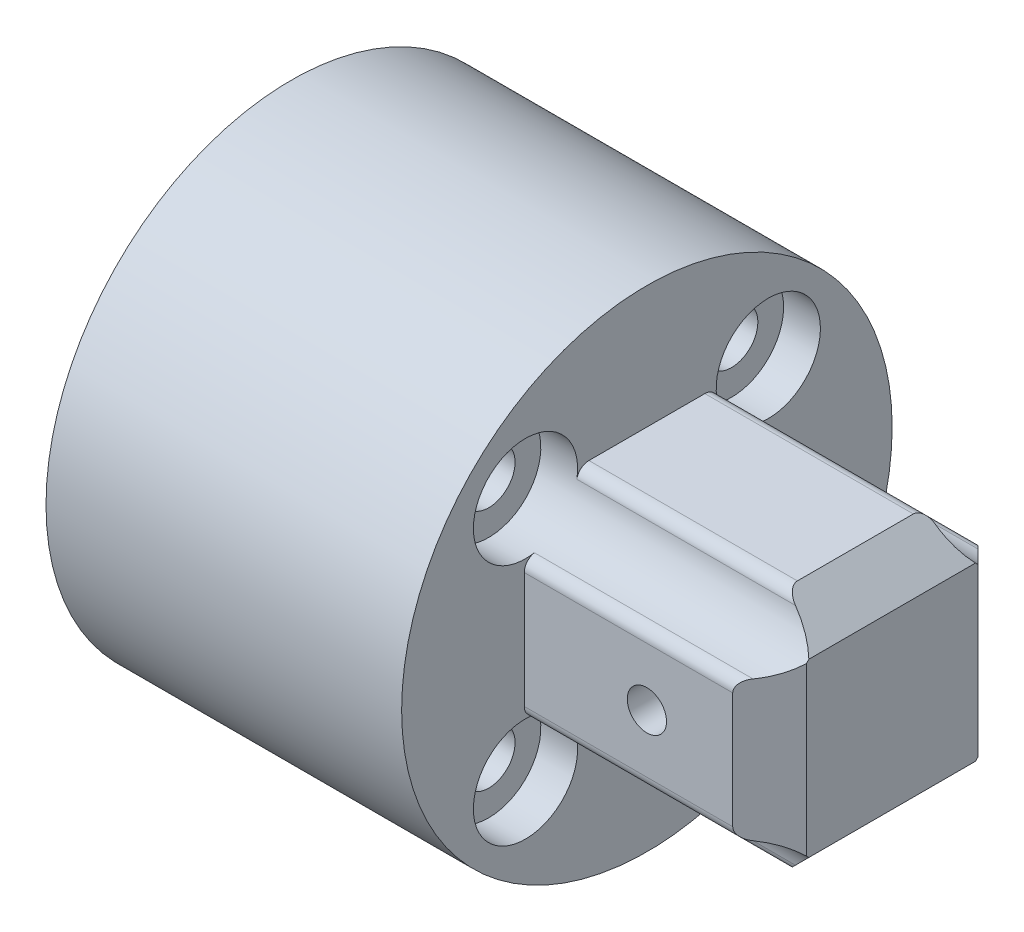
from build123d import *

# Parameters (mm, degrees)
SKETCH_1_R               = 20
EXTRUDE_1_DEPTH          = 10
SKETCH_2_W               = 15
SKETCH_2_H               = 30.5
CUT_EXTRUDE_1_DEPTH      = 4
SKETCH_3_R               = 8.75
CUT_EXTRUDE_2_DEPTH      = 4
EXTRUDE_START            = 19
SKETCH_4_R               = 20
SKETCH_4_W               = 18
SKETCH_4_H               = 32
EXTRUDE_2_DEPTH          = 19
FILLET_1_R               = 3
SKETCH_5_R               = 2.5
CUT_EXTRUDE_3_DEPTH      = 20
FILLET_2_R               = 3
SKETCH_6_R               = 2.15
CUT_EXTRUDE_4_DEPTH      = 43
FILLET_3_R               = 1
SKETCH_7_R               = 4.25
CUT_EXTRUDE_5_DEPTH      = 3
PATTERN_CIRCULAR_1_COUNT = 4
SKETCH_8_W               = 20
SKETCH_8_H               = 20
EXTRUDE_3_DEPTH          = 20
SKETCH_9_R               = 1.6
CUT_EXTRUDE_6_DEPTH      = 27
CHAMFER_1_SIZE           = 3
CUT_EXTRUDE_START        = 49
SKETCH_11_R              = 4.25
CUT_EXTRUDE_7_DEPTH      = 49
SKETCH_12_W              = 3
SKETCH_12_H              = 5
CUT_EXTRUDE_8_DEPTH      = 49
FILLET_4_R               = 1
FILLET_5_R               = 1
FILLET_6_R               = 1
FILLET_7_R               = 1


with BuildPart() as part:
    # 草图1 → 凸台-拉伸1 (new body)
    with BuildSketch(Plane(origin=(0, 0, 0), x_dir=(0, 0, -1), z_dir=(1, 0, 0))):
        Circle(SKETCH_1_R)
    extrude(amount=EXTRUDE_1_DEPTH)

    # 草图2 → 切除-拉伸1 (cut)
    with BuildSketch(Plane.ZY):
        Rectangle(SKETCH_2_W, SKETCH_2_H)
    extrude(amount=-CUT_EXTRUDE_1_DEPTH, mode=Mode.SUBTRACT)

    # 草图3 → 切除-拉伸2 (cut)
    with BuildSketch(Plane.ZY.offset(-4)):
        Circle(SKETCH_3_R)
    extrude(amount=CUT_EXTRUDE_2_DEPTH, mode=Mode.SUBTRACT)

    # 草图4 → 凸台-拉伸2 (add)
    with BuildSketch(Plane.ZY.offset(EXTRUDE_START)):
        Circle(SKETCH_4_R)
        Rectangle(SKETCH_4_W, SKETCH_4_H, mode=Mode.SUBTRACT)
    extrude(amount=-EXTRUDE_2_DEPTH)

    # 圆角1
    fillet_1_edges = [part.edges().sort_by_distance(p)[0] for p in [
        (-9.5, 16, 9),
        (-9.5, 16, -9),
        (-9.5, -16, -9),
        (-9.5, -16, 9),
    ]]
    fillet(fillet_1_edges, radius=FILLET_1_R)

    # 草图5 → 切除-拉伸3 (cut)
    with BuildSketch(Plane.ZY.offset(19)):
        with Locations((0, -16)):
            Circle(SKETCH_5_R)
        with Locations((0, 16)):
            Circle(SKETCH_5_R)
    extrude(amount=-CUT_EXTRUDE_3_DEPTH, mode=Mode.SUBTRACT)

    # 圆角2
    # the kernel refuses this fillet: 3 mm, written as the material it takes off along each edge
    with BuildSketch(Plane(origin=(-24.274430572, -16, 2.5), x_dir=(0, -0.9586814917396833, -0.2844816292764363), z_dir=(1, 0, 0))) as fillet_2_piece_1:
        with BuildLine():
            CenterArc((2.275853034, -2.876044475), FILLET_2_R, 106.527865575, 56.944268849)
            Line((-0.600191441, -2.022599587), (0, 0))
            ThreePointArc((0, 0), (0.711204073, -0.103296271), (1.422408146, 0))
        make_face()
    extrude(amount=24.274430572, mode=Mode.SUBTRACT)
    with BuildSketch(Plane(origin=(0, -16, -2.5), x_dir=(0, 0, -1), z_dir=(-1, 0, 0))) as fillet_2_piece_2:
        with BuildLine():
            CenterArc((2.109772229, 3), FILLET_2_R, 213.055731151, 56.944268849)
            ThreePointArc((-0.404648987, 1.363636364), (-0.103296271, 0.711204073), (0, 0))
            Line((0, 0), (2.109772229, 0))
        make_face()
    extrude(amount=24.274430572, mode=Mode.SUBTRACT)
    with BuildSketch(Plane(origin=(0, 16, -2.5), x_dir=(0, 0.9586814917396834, 0.2844816292764354), z_dir=(-1, 0, 0))) as fillet_2_piece_3:
        with BuildLine():
            CenterArc((2.275853034, 2.876044475), FILLET_2_R, 196.527865575, 56.944268849)
            Line((-0.600191441, 2.022599587), (0, 0))
            ThreePointArc((0, 0), (0.711204073, 0.103296271), (1.422408146, 0))
        make_face()
    extrude(amount=24.274430572, mode=Mode.SUBTRACT)
    with BuildSketch(Plane(origin=(-24.274430572, 16, 2.5), x_dir=(0, 0, 1), z_dir=(1, 0, 0))) as fillet_2_piece_4:
        with BuildLine():
            CenterArc((2.109772229, -3), FILLET_2_R, 90, 56.944268849)
            ThreePointArc((-0.404648987, -1.363636364), (-0.103296271, -0.711204073), (0, 0))
            Line((0, 0), (2.109772229, 0))
        make_face()
    extrude(amount=24.274430572, mode=Mode.SUBTRACT)

    # 草图6 → 切除-拉伸4 (cut)
    with BuildSketch(Plane(origin=(10, 0, 0), x_dir=(0, 0, -1), z_dir=(1, 0, 0))):
        with Locations((9.899494937, -9.899494937)):
            Circle(SKETCH_6_R)
        with Locations((-9.899494937, -9.899494937)):
            Circle(SKETCH_6_R)
        with Locations((-9.899494937, 9.899494937)):
            Circle(SKETCH_6_R)
        with Locations((9.899494937, 9.899494937)):
            Circle(SKETCH_6_R)
    extrude(amount=-CUT_EXTRUDE_4_DEPTH, mode=Mode.SUBTRACT)

    # 圆角3
    # the kernel refuses this fillet: 1 mm, written as the material it takes off along each edge
    with BuildSketch(Plane(origin=(-21.98900269, -7.946699797, 9), x_dir=(0, 0.1985408891964352, 0.9800926054802622), z_dir=(1, 0, 0)), Plane(origin=(-21.98900269, 7.946699797, -9), x_dir=(0, -0.19854088919647347, -0.9800926054802545), z_dir=(1, 0, 0))) as fillet_3_piece_1:
        with BuildLine():
            CenterArc((1.217468306, -0.973258884), FILLET_3_R, 103.280057781, 88.171589383)
            Line((0.237375701, -1.171799774), (0, 0))
            ThreePointArc((0, 0), (0.493878653, -0.057493399), (0.987757305, 0))
        make_face()
    extrude(amount=21.98900269, mode=Mode.SUBTRACT)
    with BuildSketch(Plane(origin=(-21.959087911, -11.852290077, 9), x_dir=(0, -0.999999983485678, -0.00018173784322620402), z_dir=(1, 0, 0)), Plane(origin=(-21.959087911, 11.852290077, -9), x_dir=(0, 0.9999999834856781, 0.00018173784322619477), z_dir=(1, 0, 0))) as fillet_3_piece_2:
        with BuildLine():
            CenterArc((1.195428513, -0.999930456), FILLET_3_R, 90.675724778, 87.490671362)
            Line((0.195940547, -0.967933494), (0.09599175, -0.964733798))
            ThreePointArc((0.09599175, -0.964733798), (0.056286672, -0.492404834), (-0.090835283, -0.041820466))
            Line((-0.090835283, -0.041820466), (1.8174e-05, 0.099999998))
            ThreePointArc((1.8174e-05, 0.099999998), (1.147728078, 0.099791416), (1.182455829, 0.099993046))
            Line((1.182455829, 0.099993046), (1.183635164, 0))
        make_face()
    extrude(amount=21.959087911, mode=Mode.SUBTRACT)
    with BuildSketch(Plane(origin=(-21.959087911, -11.852290077, -9), x_dir=(0, -0.19858553154825268, -0.98008356105982), z_dir=(1, 0, 0)), Plane(origin=(-21.959087911, 11.852290077, 9), x_dir=(0, 0.19858553154822475, 0.9800835610598256), z_dir=(1, 0, 0))) as fillet_3_piece_3:
        with BuildLine():
            CenterArc((1.217233349, -0.973269347), FILLET_3_R, 103.277447997, 87.490671362)
            Line((0.234841987, -1.160104066), (0.136602851, -1.178787538))
            ThreePointArc((0.136602851, -1.178787538), (0.129910229, -1.144710182), (-0.098008356, -0.019858553))
            Line((-0.098008356, -0.019858553), (0.022966667, 0.097326935))
            ThreePointArc((0.022966667, 0.097326935), (0.49378334, 0.042529095), (0.964600013, 0.097326935))
            Line((0.964600013, 0.097326935), (0.987566679, 0))
        make_face()
    extrude(amount=21.959087911, mode=Mode.SUBTRACT)
    with BuildSketch(Plane(origin=(-21.98900269, -7.946699797, -9), x_dir=(0, 1, 0), z_dir=(1, 0, 0)), Plane(origin=(-21.98900269, 7.946699797, 9), x_dir=(0, -1, 0), z_dir=(1, 0, 0))) as fillet_3_piece_4:
        with BuildLine():
            CenterArc((1.195601076, -1), FILLET_3_R, 90, 88.171589383)
            ThreePointArc((0.196110214, -0.968093631), (0.154403962, -0.472632025), (0, 0))
            Line((0, 0), (1.195601076, 0))
        make_face()
    extrude(amount=21.98900269, mode=Mode.SUBTRACT)

    # 草图7 → 切除-拉伸5 (cut)
    with BuildSketch(Plane(origin=(10, 0, 0), x_dir=(0, 0, -1), z_dir=(1, 0, 0))):
        with Locations((9.899494937, -9.899494937)):
            Circle(SKETCH_7_R)
    cut_extrude_5 = extrude(amount=-CUT_EXTRUDE_5_DEPTH, mode=Mode.SUBTRACT)

    # 阵列(圆周)1: 切除-拉伸5 ×4 about axis
    pattern_circular_1_axis = Axis((0, 0, 0), (1, 0, 0))
    for i in range(1, PATTERN_CIRCULAR_1_COUNT):
        add(cut_extrude_5.rotate(pattern_circular_1_axis, i * 360 / PATTERN_CIRCULAR_1_COUNT), mode=Mode.SUBTRACT)

    # 草图8 → 凸台-拉伸3 (add)
    with BuildSketch(Plane(origin=(10, 0, 0), x_dir=(0, 0, -1), z_dir=(1, 0, 0))):
        Rectangle(SKETCH_8_W, SKETCH_8_H)
    extrude(amount=EXTRUDE_3_DEPTH)

    # 草图9 → 切除-拉伸6 (cut)
    with BuildSketch(Plane(origin=(0, 0, -10), x_dir=(-1, 0, 0), z_dir=(0, 0, -1))):
        with Locations((-20, 0)):
            Circle(SKETCH_9_R)
    extrude(amount=-CUT_EXTRUDE_6_DEPTH, mode=Mode.SUBTRACT)

    # 倒角1
    chamfer_1_edges = [part.edges().sort_by_distance(p)[0] for p in [
        (30, 0, -10),
        (30, 10, 0),
        (30, 0, 10),
        (30, -10, 0),
    ]]
    chamfer(chamfer_1_edges, length=CHAMFER_1_SIZE)

    # 草图11 → 切除-拉伸7 (cut)
    with BuildSketch(Plane(origin=(10, 0, 0), x_dir=(0, 0, -1), z_dir=(1, 0, 0)).offset(CUT_EXTRUDE_START)):
        with Locations(Location((-9.899494937, 9.899494937, 0), (0, 0, 1.355071251))):
            Circle(SKETCH_11_R)
        with Locations(Location((-9.899494937, -9.899494937, 0), (0, 0, 358.644928749))):
            Circle(SKETCH_11_R)
        with Locations((9.899494937, -9.899494937)):
            Circle(SKETCH_11_R)
        with Locations(Location((9.899494937, 9.899494937, 0), (0, 0, 271.355071251))):
            Circle(SKETCH_11_R)
    extrude(amount=-CUT_EXTRUDE_7_DEPTH, mode=Mode.SUBTRACT)

    # 草图12 → 切除-拉伸8 (cut)
    with BuildSketch(Plane(origin=(0, -15.25, 0), x_dir=(1, 0, 0), z_dir=(0, 1, 0))):
        Rectangle(SKETCH_12_W, SKETCH_12_H)
    extrude(amount=-CUT_EXTRUDE_8_DEPTH, mode=Mode.SUBTRACT)

    # 圆角4
    fillet_4_edges = [part.edges().sort_by_distance(p)[0] for p in [
        (0.75, -15.25, -2.5),
        (0.75, -15.25, 2.5),
        (1.5, -15.25, 0),
    ]]
    fillet(fillet_4_edges, radius=FILLET_4_R)

    # 圆角5
    # the kernel refuses this fillet: 1 mm, written as the material it takes off along each edge
    with BuildSketch(Plane(origin=(1.5, 0, 0), x_dir=(0, -0.9688309462653072, -0.24772282405678642), z_dir=(0, 0.24772282405678642, -0.9688309462653072))) as fillet_5_piece_1_section:
        with BuildLine():
            CenterArc((20 - FILLET_5_R, -FILLET_5_R), FILLET_5_R, 0, 90)
            Line((20 - FILLET_5_R, 0), (20, 0))
            Line((20, 0), (20, -FILLET_5_R))
        make_face()
    fillet_5_piece_1 = revolve(axis=Axis((1.5, 0, 0), (-1, 0, 0)), revolution_arc=28.685602918, mode=Mode.PRIVATE)
    fillet_5_piece_1 = split(fillet_5_piece_1, bisect_by=Plane(origin=(1.726387523, -19.720664974, 2.5), z_dir=(0, 0, -1)), keep=Keep.TOP, mode=Mode.PRIVATE)
    fillet_5_piece_1 = split(fillet_5_piece_1, bisect_by=Plane(origin=(1.726387523, -19.720664974, -2.5), z_dir=(0, 0, 1)), keep=Keep.TOP, mode=Mode.PRIVATE)
    add(fillet_5_piece_1, mode=Mode.SUBTRACT)
    with BuildSketch(Plane(origin=(0, -19.843134833, -2.5), x_dir=(0, 0.15467472418788475, -0.9879654496476087), z_dir=(-1, 0, 0))) as fillet_5_piece_2:
        with BuildLine():
            CenterArc((1.168669677, -0.999550922), FILLET_5_R, 88.282823965, 100.61510785)
            Line((0.180704228, -1.154225646), (0, 0))
            ThreePointArc((0, 0), (0.599317783, 0.008981562), (1.198635566, 0))
        make_face()
    extrude(amount=1.5, mode=Mode.SUBTRACT)
    with BuildSketch(Plane(origin=(-1.5, 0, 0), x_dir=(0, -0.968830946265307, -0.24772282405678675), z_dir=(0, 0.24772282405678675, -0.968830946265307))) as fillet_5_piece_3_section:
        with BuildLine():
            CenterArc((20 - FILLET_5_R, FILLET_5_R), FILLET_5_R, 270, 90)
            Line((20 - FILLET_5_R, 0), (20, 0))
            Line((20, 0), (20, FILLET_5_R))
        make_face()
    fillet_5_piece_3 = revolve(axis=Axis((-1.5, 0, 0), (-1, 0, 0)), revolution_arc=28.685602918, mode=Mode.PRIVATE)
    fillet_5_piece_3 = split(fillet_5_piece_3, bisect_by=Plane(origin=(-1.726387523, -19.720664974, 2.5), z_dir=(0, 0, -1)), keep=Keep.TOP, mode=Mode.PRIVATE)
    fillet_5_piece_3 = split(fillet_5_piece_3, bisect_by=Plane(origin=(-1.726387523, -19.720664974, -2.5), z_dir=(0, 0, 1)), keep=Keep.TOP, mode=Mode.PRIVATE)
    add(fillet_5_piece_3, mode=Mode.SUBTRACT)
    with BuildSketch(Plane(origin=(0, -19.843134833, 2.5), x_dir=(0, 1, 0), z_dir=(-1, 0, 0)), Plane(origin=(1.5, -19.843134833, 2.5), x_dir=(0, 1, 0), z_dir=(-1, 0, 0))) as fillet_5_piece_4:
        with BuildLine():
            CenterArc((1.168285436, -1), FILLET_5_R, 90, 100.615107851)
            ThreePointArc((0.185398626, -1.184210526), (0.08382584, -0.593494484), (0, 0))
            Line((0, 0), (1.168285436, 0))
        make_face()
    extrude(amount=1.5, mode=Mode.SUBTRACT)
    with BuildSketch(Plane(origin=(1.5, -19.843134833, -2.5), x_dir=(0, 1, 0), z_dir=(-1, 0, 0))) as fillet_5_piece_5:
        with BuildLine():
            CenterArc((1.168285436, 1), FILLET_5_R, 169.384892149, 100.615107851)
            ThreePointArc((0.185398626, 1.184210526), (0.08382584, 0.593494484), (0, 0))
            Line((0, 0), (1.168285436, 0))
        make_face()
    extrude(amount=1.5, mode=Mode.SUBTRACT)
    with BuildSketch(Plane(origin=(4.496588916, -19.843134833, -2.5), x_dir=(0, 1, 0), z_dir=(-1, 0, 0))) as fillet_5_piece_6a_section:
        with BuildLine():
            CenterArc((1.168285436, 1), FILLET_5_R, 169.384892149, 100.615107851)
            ThreePointArc((0.185398626, 1.184210526), (0.08382584, 0.593494484), (0, 0))
            Line((0, 0), (1.168285436, 0))
        make_face()
    fillet_5_piece_6a = extrude(amount=4.496588916, mode=Mode.PRIVATE)
    fillet_5_piece_6a = split(fillet_5_piece_6a, bisect_by=Plane(origin=(1.5, -19.536518623, -2.774368231), z_dir=(1, 0, 0)), keep=Keep.TOP, mode=Mode.PRIVATE)
    with BuildSketch(Plane(origin=(1.5, 0, 0), x_dir=(0, -0.9688309462653072, -0.24772282405678642), z_dir=(0, 0.24772282405678642, -0.9688309462653072))) as fillet_5_piece_6b_section:
        with BuildLine():
            CenterArc((20 - FILLET_5_R, -FILLET_5_R), FILLET_5_R, 0, 90)
            Line((20 - FILLET_5_R, 0), (20, 0))
            Line((20, 0), (20, -FILLET_5_R))
        make_face()
    fillet_5_piece_6b = revolve(axis=Axis((1.5, 0, 0), (-1, 0, 0)), revolution_arc=28.685602918, mode=Mode.PRIVATE)
    fillet_5_piece_6b = split(fillet_5_piece_6b, bisect_by=Plane(origin=(1.729216038, -19.415537877, -2.5), z_dir=(0, 0, -1)), keep=Keep.TOP, mode=Mode.PRIVATE)
    fillet_5_piece_6 = fillet_5_piece_6a & fillet_5_piece_6b
    add(fillet_5_piece_6, mode=Mode.SUBTRACT)
    with BuildSketch(Plane(origin=(4.496588916, -19.843134833, 2.5), x_dir=(0, 1, 0), z_dir=(-1, 0, 0))) as fillet_5_piece_7a_section:
        with BuildLine():
            CenterArc((1.168285436, -1), FILLET_5_R, 90, 100.615107851)
            ThreePointArc((0.185398626, -1.184210526), (0.08382584, -0.593494484), (0, 0))
            Line((0, 0), (1.168285436, 0))
        make_face()
    fillet_5_piece_7a = extrude(amount=4.496588916, mode=Mode.PRIVATE)
    fillet_5_piece_7a = split(fillet_5_piece_7a, bisect_by=Plane(origin=(1.5, -19.536518623, 2.774368231), z_dir=(1, 0, 0)), keep=Keep.TOP, mode=Mode.PRIVATE)
    with BuildSketch(Plane(origin=(1.5, 0, 0), x_dir=(0, -0.9688309462653072, -0.24772282405678642), z_dir=(0, 0.24772282405678642, -0.9688309462653072))) as fillet_5_piece_7b_section:
        with BuildLine():
            CenterArc((20 - FILLET_5_R, -FILLET_5_R), FILLET_5_R, 0, 90)
            Line((20 - FILLET_5_R, 0), (20, 0))
            Line((20, 0), (20, -FILLET_5_R))
        make_face()
    fillet_5_piece_7b = revolve(axis=Axis((1.5, 0, 0), (-1, 0, 0)), revolution_arc=28.685602918, mode=Mode.PRIVATE)
    fillet_5_piece_7b = split(fillet_5_piece_7b, bisect_by=Plane(origin=(1.729216093, -19.415538131, 2.5), z_dir=(0, 0, 1)), keep=Keep.TOP, mode=Mode.PRIVATE)
    fillet_5_piece_7 = fillet_5_piece_7a & fillet_5_piece_7b
    add(fillet_5_piece_7, mode=Mode.SUBTRACT)
    with BuildSketch(Plane(origin=(-1.5, 0, 0), x_dir=(0, -0.968830946265307, -0.24772282405678675), z_dir=(0, 0.24772282405678675, -0.968830946265307))) as fillet_5_piece_8a_section:
        with BuildLine():
            CenterArc((20 - FILLET_5_R, FILLET_5_R), FILLET_5_R, 270, 90)
            Line((20 - FILLET_5_R, 0), (20, 0))
            Line((20, 0), (20, FILLET_5_R))
        make_face()
    fillet_5_piece_8a = revolve(axis=Axis((-1.5, 0, 0), (-1, 0, 0)), revolution_arc=28.685602918, mode=Mode.PRIVATE)
    fillet_5_piece_8a = split(fillet_5_piece_8a, bisect_by=Plane(origin=(-1.729216046, -19.415537874, -2.5), z_dir=(0, 0, -1)), keep=Keep.TOP, mode=Mode.PRIVATE)
    with BuildSketch(Plane(origin=(0, -19.843134833, -2.5), x_dir=(0, 0.15467472418788475, -0.9879654496476087), z_dir=(-1, 0, 0))) as fillet_5_piece_8b_section:
        with BuildLine():
            CenterArc((1.168669677, -0.999550922), FILLET_5_R, 88.282823965, 100.61510785)
            Line((0.180704228, -1.154225646), (0, 0))
            ThreePointArc((0, 0), (0.599317783, 0.008981562), (1.198635566, 0))
        make_face()
    fillet_5_piece_8b = extrude(amount=4.496588916, mode=Mode.PRIVATE)
    fillet_5_piece_8b = split(fillet_5_piece_8b, bisect_by=Plane(origin=(-1.5, -19.536518623, -2.774368231), z_dir=(-1, 0, 0)), keep=Keep.TOP, mode=Mode.PRIVATE)
    fillet_5_piece_8 = fillet_5_piece_8a & fillet_5_piece_8b
    add(fillet_5_piece_8, mode=Mode.SUBTRACT)
    with BuildSketch(Plane(origin=(0, -19.843134833, 2.5), x_dir=(0, 1, 0), z_dir=(-1, 0, 0))) as fillet_5_piece_9a_section:
        with BuildLine():
            CenterArc((1.168285436, -1), FILLET_5_R, 90, 100.615107851)
            ThreePointArc((0.185398626, -1.184210526), (0.08382584, -0.593494484), (0, 0))
            Line((0, 0), (1.168285436, 0))
        make_face()
    fillet_5_piece_9a = extrude(amount=4.496588916, mode=Mode.PRIVATE)
    fillet_5_piece_9a = split(fillet_5_piece_9a, bisect_by=Plane(origin=(-1.5, -19.536518623, 2.774368231), z_dir=(-1, 0, 0)), keep=Keep.TOP, mode=Mode.PRIVATE)
    with BuildSketch(Plane(origin=(-1.5, 0, 0), x_dir=(0, -0.968830946265307, -0.24772282405678675), z_dir=(0, 0.24772282405678675, -0.968830946265307))) as fillet_5_piece_9b_section:
        with BuildLine():
            CenterArc((20 - FILLET_5_R, FILLET_5_R), FILLET_5_R, 270, 90)
            Line((20 - FILLET_5_R, 0), (20, 0))
            Line((20, 0), (20, FILLET_5_R))
        make_face()
    fillet_5_piece_9b = revolve(axis=Axis((-1.5, 0, 0), (-1, 0, 0)), revolution_arc=28.685602918, mode=Mode.PRIVATE)
    fillet_5_piece_9b = split(fillet_5_piece_9b, bisect_by=Plane(origin=(-1.729216085, -19.415538134, 2.5), z_dir=(0, 0, 1)), keep=Keep.TOP, mode=Mode.PRIVATE)
    fillet_5_piece_9 = fillet_5_piece_9a & fillet_5_piece_9b
    add(fillet_5_piece_9, mode=Mode.SUBTRACT)

    # 圆角6
    # the kernel refuses this fillet: 1 mm, written as the material it takes off along each edge
    with BuildSketch(Plane(origin=(29.308895758, 5.650683487, -10), x_dir=(0, 0.07419746212957036, 0.9972435693518064), z_dir=(-1, 0, 0)), Plane(origin=(10, 10, -5.650683487), x_dir=(0, -0.9972435693518076, -0.07419746212955422), z_dir=(1, 0, 0)), Plane(origin=(10, 5.650683487, 10), x_dir=(0, 0.07419746212941858, -0.9972435693518176), z_dir=(1, 0, 0))) as fillet_6_piece_1:
        with BuildLine():
            CenterArc((0.928717887, -0.995210041), FILLET_6_R, 95.610183041, 80.134705169)
            Line((-0.068525682, -0.921012579), (0, 0))
            ThreePointArc((0, 0), (0.415479055, -0.020357325), (0.83095811, 0))
        make_face()
    extrude(amount=19.308895758, mode=Mode.SUBTRACT)
    with BuildSketch(Plane(origin=(29.308895758, 10, 5.650683487), x_dir=(0, 0, -1), z_dir=(-1, 0, 0))) as fillet_6_piece_2:
        with BuildLine():
            CenterArc((0.923558303, 1), FILLET_6_R, 189.865294831, 80.134705169)
            ThreePointArc((-0.061654983, 0.828667631), (-0.01052628, 0.415844277), (0, 0))
            Line((0, 0), (0.923558303, 0))
        make_face()
    extrude(amount=19.308895758, mode=Mode.SUBTRACT)
    with BuildSketch(Plane(origin=(10, -5.650683487, 10), x_dir=(0, 1, 0), z_dir=(1, 0, 0)), Plane(origin=(10, -10, -5.650683487), x_dir=(0, 0, 1), z_dir=(1, 0, 0))) as fillet_6_piece_3:
        with BuildLine():
            CenterArc((0.923558303, -1), FILLET_6_R, 90, 80.134705169)
            ThreePointArc((-0.061654983, -0.828667631), (-0.01052628, -0.415844277), (0, 0))
            Line((0, 0), (0.923558303, 0))
        make_face()
    extrude(amount=19.308895758, mode=Mode.SUBTRACT)
    with BuildSketch(Plane(origin=(29.308895758, -10, 5.650683487), x_dir=(0, 0.997243569351808, 0.0741974621295495), z_dir=(-1, 0, 0))) as fillet_6_piece_4:
        with BuildLine():
            CenterArc((0.928717887, 0.995210041), FILLET_6_R, 184.25511179, 80.134705169)
            Line((-0.068525682, 0.921012579), (0, 0))
            ThreePointArc((0, 0), (0.415479055, 0.020357325), (0.83095811, 0))
        make_face()
    extrude(amount=19.308895758, mode=Mode.SUBTRACT)

    # 圆角7
    fillet_7_edges = [part.edges().sort_by_distance(p)[0] for p in [
        (18.5, -5.650683487, -10),
    ]]
    fillet(fillet_7_edges, radius=FILLET_7_R)


solid = part.part
